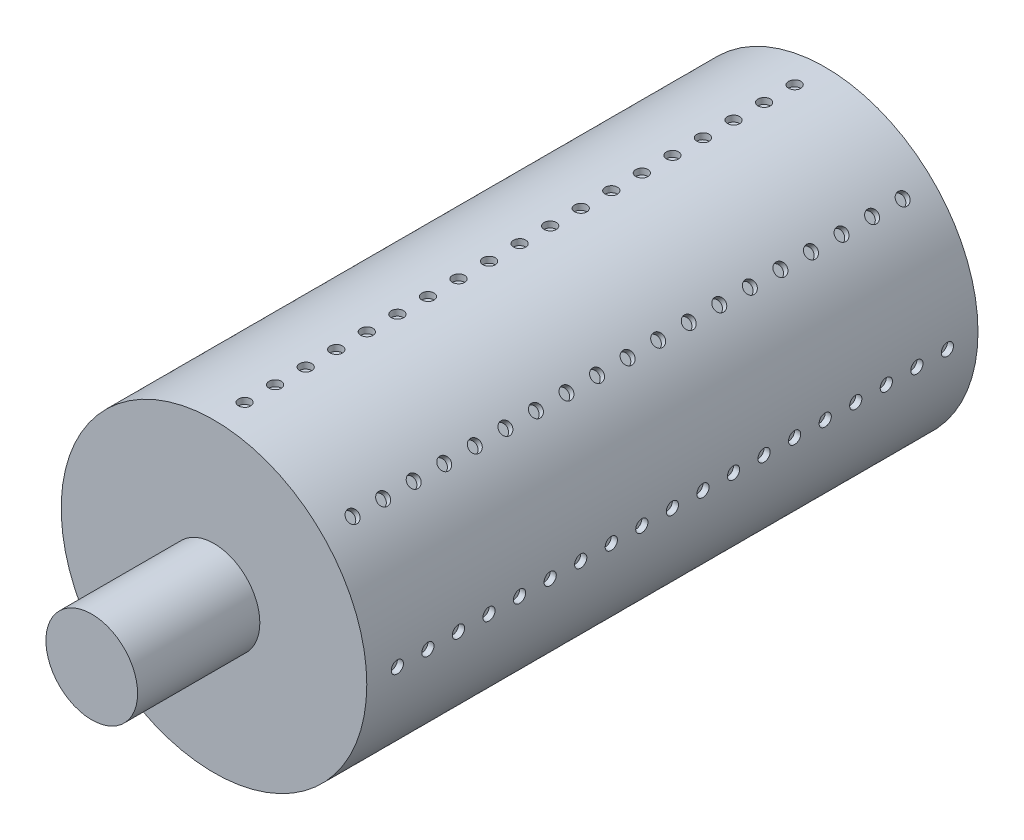
from build123d import *

# Parameters (mm, degrees)
SKETCH_1_R               = 25
SKETCH_3_R               = 1
CUT_EXTRUDE_1_DEPTH      = 6
PATTERN_CIRCULAR_1_COUNT = 8
SKETCH_4_W               = 20
SKETCH_4_H               = 5
CUT_EXTRUDE_2_DEPTH      = 5
SKETCH_6_R               = 7.5
EXTRUDE_1_DEPTH          = 20


with BuildPart() as part:
    # 扫描1: sweep along a path in 草图2
    with BuildLine(Plane(origin=(0, 0, 0), x_dir=(1, 0, 0), z_dir=(0, 1, 0))) as sweep_1_path:
        Line((0, 0), (0, 100))
    # 草图1 → 扫描1 (sweep)
    with BuildSketch(Plane.XY):
        Circle(SKETCH_1_R)
    sweep(path=sweep_1_path.line)

    # 草图3 → 切除-拉伸1 (cut)
    with BuildSketch(Plane(origin=(0, 30, 0), x_dir=(1, 0, 0), z_dir=(0, 1, 0))):
        with Locations((0, 50)):
            Circle(SKETCH_3_R)
        with Locations((0, 55)):
            Circle(SKETCH_3_R)
        with Locations((0, 60)):
            Circle(SKETCH_3_R)
        with Locations((0, 65)):
            Circle(SKETCH_3_R)
        with Locations((0, 70)):
            Circle(SKETCH_3_R)
        with Locations((0, 75)):
            Circle(SKETCH_3_R)
        with Locations((0, 80)):
            Circle(SKETCH_3_R)
        with Locations((0, 85)):
            Circle(SKETCH_3_R)
        with Locations((0, 90)):
            Circle(SKETCH_3_R)
        with Locations((0, 95)):
            Circle(SKETCH_3_R)
        with Locations((0, 5)):
            Circle(SKETCH_3_R)
        with Locations((0, 10)):
            Circle(SKETCH_3_R)
        with Locations((0, 15)):
            Circle(SKETCH_3_R)
        with Locations((0, 20)):
            Circle(SKETCH_3_R)
        with Locations((0, 25)):
            Circle(SKETCH_3_R)
        with Locations((0, 30)):
            Circle(SKETCH_3_R)
        with Locations((0, 35)):
            Circle(SKETCH_3_R)
        with Locations((0, 40)):
            Circle(SKETCH_3_R)
        with Locations((0, 45)):
            Circle(SKETCH_3_R)
    cut_extrude_1 = extrude(amount=-CUT_EXTRUDE_1_DEPTH, mode=Mode.SUBTRACT)

    # 阵列(圆周)1: 切除-拉伸1 ×8 about axis
    pattern_circular_1_axis = Axis((0, 0, -100), (0, 0, 1))
    for i in range(1, PATTERN_CIRCULAR_1_COUNT):
        add(cut_extrude_1.rotate(pattern_circular_1_axis, i * 360 / PATTERN_CIRCULAR_1_COUNT), mode=Mode.SUBTRACT)

    # 草图4 → 切除-拉伸2 (cut)
    with BuildSketch(Plane(origin=(0, 0, -100), x_dir=(-1, 0, 0), z_dir=(0, 0, -1))):
        Rectangle(SKETCH_4_W, SKETCH_4_H)
    extrude(amount=-CUT_EXTRUDE_2_DEPTH, mode=Mode.SUBTRACT)

    # 草图6 → 凸台-拉伸1 (add)
    with BuildSketch(Plane.XY):
        Circle(SKETCH_6_R)
    extrude(amount=EXTRUDE_1_DEPTH)


solid = part.part
